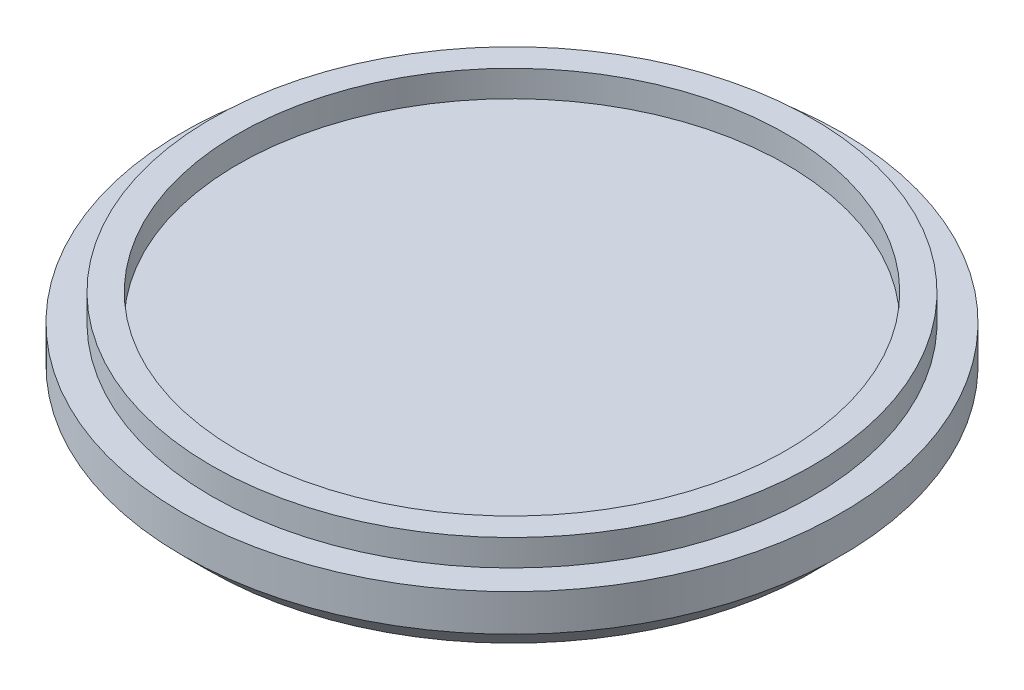
from build123d import *

# Parameters (mm, degrees)
BOSS_EXTRUDE1_DEPTH      = 1.4
BOSS_EXTRUDE1_DEPTH_BACK = 1
SKETCH1_R                = 12.5
SKETCH2_R                = 11.4
SKETCH2_R_2              = 10.4
BOSS_EXTRUDE2_DEPTH      = 1
CHAMFER1_SIZE            = 1
CUT_EXTRUDE6_DEPTH       = 0.4


with BuildPart() as part:
    # Sketch1 → Boss-Extrude1 (new, two sides: drawn at the far end of the back side and taken through both)
    with BuildSketch(Plane(origin=(0, 0, 0), x_dir=(1, 0, 0), z_dir=(0, 1, 0)).offset(-BOSS_EXTRUDE1_DEPTH_BACK)):
        with Locations(Location((0, 0, 0), (0, 0, 270))):
            Circle(SKETCH1_R)
    extrude(amount=BOSS_EXTRUDE1_DEPTH + BOSS_EXTRUDE1_DEPTH_BACK)

    # Sketch2 → Boss-Extrude2 (add)
    with BuildSketch(Plane(origin=(0, 1.4, 0), x_dir=(1, 0, 0), z_dir=(0, 1, 0))):
        with Locations(Location((0, 0, 0), (0, 0, 270))):
            Circle(SKETCH2_R)
        with Locations(Location((0, 0, 0), (0, 0, 270))):
            Circle(SKETCH2_R_2, mode=Mode.SUBTRACT)
    extrude(amount=BOSS_EXTRUDE2_DEPTH)

    # Chamfer1
    chamfer1_edges = [part.edges().sort_by_distance(p)[0] for p in [
        (0, -1, -12.5),
    ]]
    chamfer(chamfer1_edges, length=CHAMFER1_SIZE - 0.0001)  # a hair under: the kernel refuses the full size

    # Sketch8 → Cut-Extrude6 (cut)
    with BuildSketch(Plane.XZ.offset(1)):
        with BuildLine():
            Line((4.07421875, 4.375), (-2.1, 4.375))
            Line((-2.1, 4.375), (-2.1, 1.05))
            Line((-2.1, 1.05), (3.584765625, 1.05))
            add(Edge.make_bspline(
                [(3.584765625, 1.05), (3.683414496, 1.046266561), (3.868584149, 1.03925868), (4.127786585, 0.989689139), (4.346999538, 0.898706669), (4.525338462, 0.771743669), (4.662303563, 0.613832259), (4.762986434, 0.433813713), (4.821847618, 0.22778939), (4.828290287, 0.083326956), (4.831640625, 0.008203125)],
                knots=[0, 0, 0, 0, 1.285293232, 2.412569968, 3.418386025, 4.354403319, 5.23810445, 6.120527863, 7.022630715, 8, 8, 8, 8], degree=3))
            add(Edge.make_bspline(
                [(4.831640625, 0.008203125), (4.828384414, -0.066966736), (4.82212275, -0.211517688), (4.761888965, -0.417277321), (4.664922704, -0.60107826), (4.529268349, -0.762310942), (4.352406057, -0.893955903), (4.132637348, -0.987206532), (3.871609167, -1.039986965), (3.684368347, -1.046523103), (3.584765625, -1.05)],
                knots=[0, 0, 0, 0, 0.971200242, 1.867609123, 2.749214551, 3.645234956, 4.57279535, 5.576919765, 6.711042891, 8, 8, 8, 8], degree=3))
            Line((3.584765625, -1.05), (-2.1, -1.05))
            Line((-2.1, -1.05), (-2.1, -4.9))
            Line((-2.1, -4.9), (4.2875, -4.9))
            add(Edge.make_bspline(
                [(4.2875, -4.9), (4.388861848, -4.903792751), (4.579411283, -4.910922716), (4.847992302, -4.960158814), (5.075597112, -5.053685525), (5.263543825, -5.181722918), (5.412072035, -5.338872712), (5.514235934, -5.525740129), (5.58059817, -5.734099342), (5.586185244, -5.882024152), (5.5890625, -5.958203125)],
                knots=[0, 0, 0, 0, 1.281412047, 2.408917619, 3.431661904, 4.368016538, 5.264760761, 6.136510243, 7.040331808, 8, 8, 8, 8], degree=3))
            add(Edge.make_bspline(
                [(5.5890625, -5.958203125), (5.58633538, -6.032618077), (5.581072924, -6.176214785), (5.513038458, -6.378588348), (5.411333521, -6.561610493), (5.26351397, -6.718079765), (5.076230138, -6.847091674), (4.84693188, -6.935464254), (4.579917838, -6.99038683), (4.388974679, -6.996664043), (4.2875, -7)],
                knots=[0, 0, 0, 0, 0.944744106, 1.823049547, 2.692159438, 3.596595969, 4.540982691, 5.5681055, 6.707595947, 8, 8, 8, 8], degree=3))
            Line((4.2875, -7), (-3.1171875, -7))
            add(Edge.make_bspline(
                [(-3.1171875, -7), (-3.250668685, -6.996115514), (-3.499062513, -6.988886912), (-3.843210801, -6.9154574), (-4.13006517, -6.794002261), (-4.361921166, -6.615323708), (-4.529538591, -6.372693255), (-4.646563385, -6.075591851), (-4.711828234, -5.719439126), (-4.720407168, -5.463553728), (-4.725, -5.3265625)],
                knots=[0, 0, 0, 0, 1.189456171, 2.21344733, 3.119993849, 3.948013107, 4.78741338, 5.71757596, 6.778077714, 8, 8, 8, 8], degree=3))
            Line((-4.725, -5.3265625), (-4.725, 4.8015625))
            add(Edge.make_bspline(
                [(-4.725, 4.8015625), (-4.722897792, 4.895529375), (-4.718905933, 5.073961966), (-4.689215801, 5.328670238), (-4.638698759, 5.55670946), (-4.564380189, 5.759131594), (-4.469499051, 5.937304781), (-4.346451413, 6.088099292), (-4.199394628, 6.212046955), (-4.029553563, 6.312609172), (-3.834457239, 6.384510805), (-3.617609334, 6.440451749), (-3.374933573, 6.468369986), (-3.205653623, 6.472724382), (-3.1171875, 6.475)],
                knots=[0, 0, 0, 0, 1.257097402, 2.387087425, 3.425508426, 4.374733264, 5.264346199, 6.113849079, 6.961774747, 7.825601221, 8.740599092, 9.73444991, 10.816017894, 12, 12, 12, 12], degree=3))
            Line((-3.1171875, 6.475), (4.07421875, 6.475))
            add(Edge.make_bspline(
                [(4.07421875, 6.475), (4.176457481, 6.471126765), (4.368749199, 6.463841942), (4.638739507, 6.415846948), (4.864876279, 6.321013969), (5.050994869, 6.19434625), (5.190969541, 6.034918564), (5.297302215, 5.855179123), (5.35773805, 5.64934083), (5.364242009, 5.504673744), (5.367578125, 5.43046875)],
                knots=[0, 0, 0, 0, 1.304353081, 2.453241492, 3.474309848, 4.409392115, 5.298405909, 6.157667996, 7.055001114, 8, 8, 8, 8], degree=3))
            add(Edge.make_bspline(
                [(5.367578125, 5.43046875), (5.364372303, 5.354401915), (5.358158277, 5.206957264), (5.296483306, 4.997297579), (5.192779923, 4.813069646), (5.050706318, 4.653232754), (4.865555272, 4.525627798), (4.637979495, 4.435054103), (4.368875398, 4.385865259), (4.176501287, 4.378771597), (4.07421875, 4.375)],
                knots=[0, 0, 0, 0, 0.962139494, 1.864969442, 2.738963821, 3.622448103, 4.551714319, 5.562017248, 6.70375977, 8, 8, 8, 8], degree=3))
        make_face()
    extrude(amount=-CUT_EXTRUDE6_DEPTH, mode=Mode.SUBTRACT)


solid = part.part
